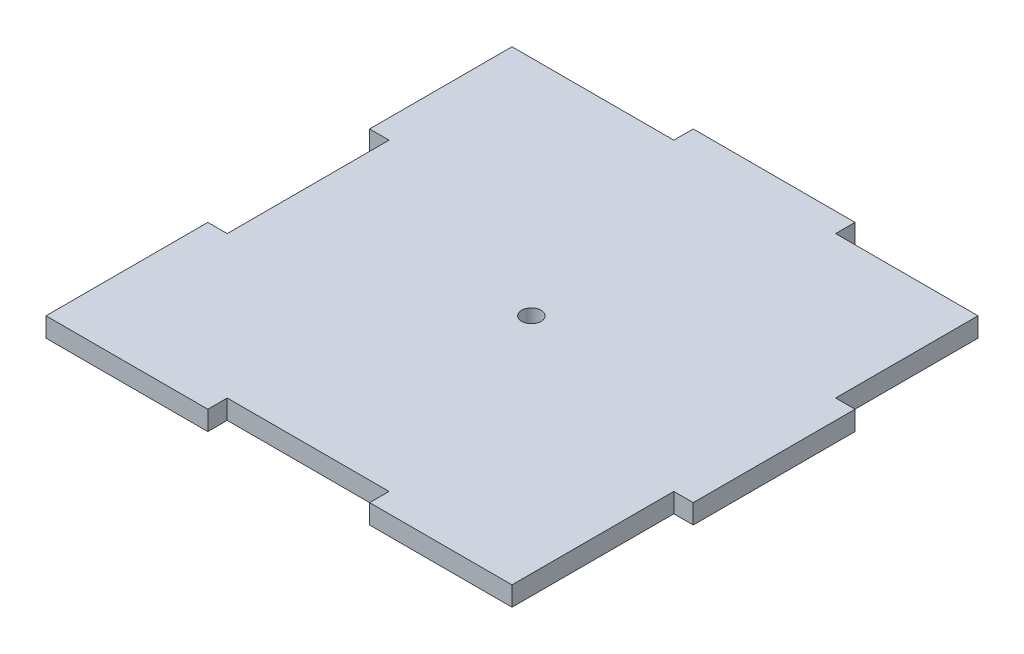
from build123d import *

# Parameters (mm, degrees)
SKETCH1_R           = 3
BOSS_EXTRUDE1_DEPTH = 6


with BuildPart() as part:
    # Sketch1 → Boss-Extrude1 (new body)
    with BuildSketch(Plane(origin=(0, 0, 0), x_dir=(1, 0, 0), z_dir=(0, 1, 0))):
        Polygon((-72, 72), (-72, 28), (-66, 28), (-66, -22), (-72, -22), (-72, -72), (-22, -72), (-22, -66), (28, -66), (28, -72), (72, -72), (72, -22), (78, -22), (78, 28), (72, 28), (72, 72), (28, 72), (28, 78), (-22, 78), (-22, 72), align=None)
        with Locations((3, 3)):
            Circle(SKETCH1_R, mode=Mode.SUBTRACT)
    extrude(amount=BOSS_EXTRUDE1_DEPTH)


solid = part.part
